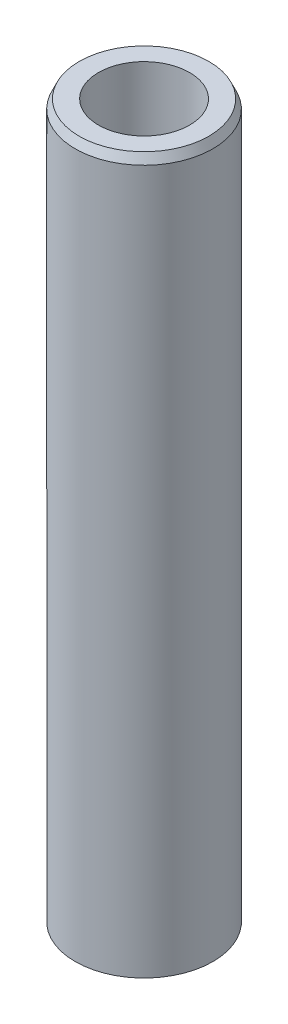
from build123d import *
from OCP.BRepFilletAPI import BRepFilletAPI_MakeChamfer

# Parameters (mm, degrees)
SKETCH1_R           = 30
BOSS_EXTRUDE1_DEPTH = 312.295103271
SKETCH2_R           = 19.854840358
CUT_EXTRUDE1_DEPTH  = 316.163816969
CHAMFER1_SIZE       = 3.867180654
CHAMFER1_SIZE2      = 1.765094831


with BuildPart() as part:
    # Sketch1 → Boss-Extrude1 (new body)
    with BuildSketch(Plane(origin=(0, 0, 0), x_dir=(1, 0, 0), z_dir=(0, 1, 0))):
        Circle(SKETCH1_R)
    extrude(amount=BOSS_EXTRUDE1_DEPTH)

    # Sketch2 → Cut-Extrude1 (cut, through all)
    with BuildSketch(Plane(origin=(0, 0, 0), x_dir=(1, 0, 0), z_dir=(0, 1, 0))):
        Circle(SKETCH2_R)
    extrude(amount=CUT_EXTRUDE1_DEPTH, mode=Mode.SUBTRACT)

    # Chamfer1: one chamfer whose edges measure the first distance from different faces: ONE call of the kernel's chamfer builder (chamfer() names one face for all edges)
    chamfer1_edges_1 = [part.edges().sort_by_distance(p)[0] for p in [
        (-30, 312.295103271, 0),
    ]]
    chamfer1_side_1 = [part.faces().sort_by_distance(p)[0] for p in [
        (-30, 156.147551635, 0),
    ]]
    chamfer1_edges_2 = [part.edges().sort_by_distance(p)[0] for p in [
        (-30, 0, 0),
    ]]
    chamfer1_side_2 = [part.faces().sort_by_distance(p)[0] for p in [
        (-29.151471863, 0, 0),
    ]]
    chamfer1 = BRepFilletAPI_MakeChamfer(part.part.solid().wrapped)
    for e in chamfer1_edges_1:
        chamfer1.Add(CHAMFER1_SIZE, CHAMFER1_SIZE2, e.wrapped, chamfer1_side_1[0].wrapped)  # the first distance lies on this face
    for e in chamfer1_edges_2:
        chamfer1.Add(CHAMFER1_SIZE, CHAMFER1_SIZE2, e.wrapped, chamfer1_side_2[0].wrapped)  # the first distance lies on this face
    add(Compound.cast(chamfer1.Shape()), mode=Mode.REPLACE)


solid = part.part
